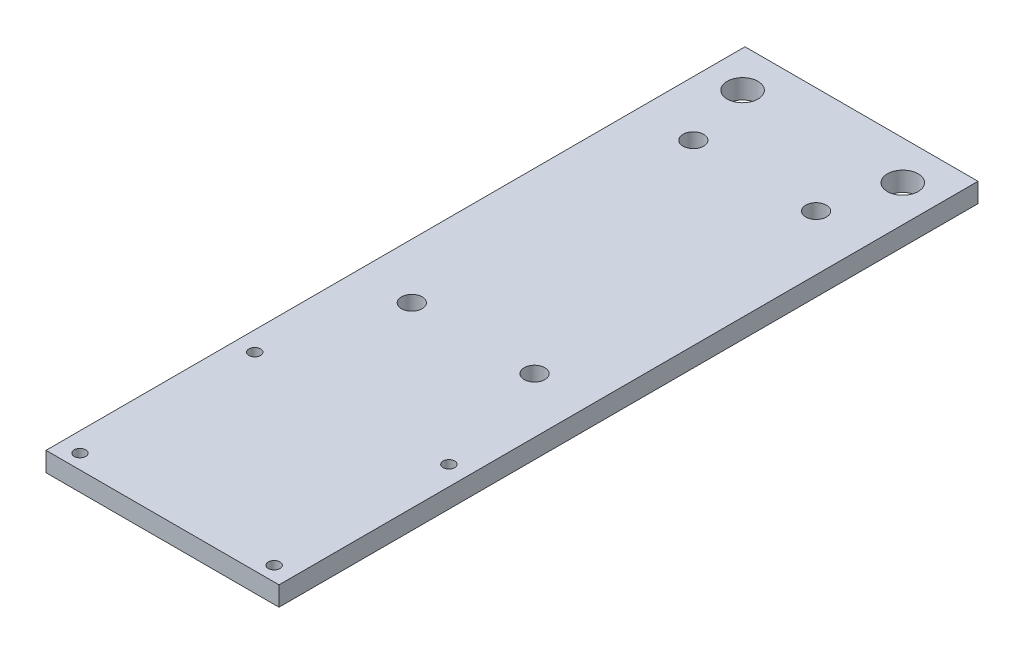
from build123d import *

# Parameters (mm, degrees)
PLATE_SKETCH_W          = 76.2
PLATE_SKETCH_H          = 228.6
PLATE_EXTRUDE_DEPTH     = 6.35
F_1_4_CLEARANCE_HOLE2_D = 6.7564
F_6_CLEARANCE_HOLE1_D   = 3.7973
F_3_8_CLEARANCE_HOLE1_D = 10.0838


with BuildPart() as part:
    # Plate sketch → Plate extrude (new body)
    with BuildSketch(Plane(origin=(0, 0, 0), x_dir=(1, 0, 0), z_dir=(0, 1, 0))):
        Rectangle(PLATE_SKETCH_W, PLATE_SKETCH_H)
    extrude(amount=PLATE_EXTRUDE_DEPTH)

    # 1/4 Clearance Hole2 (through all)
    with Locations(Plane(origin=(0, 6.35, 0), x_dir=(1, 0, 0), z_dir=(0, 1, 0))):
        with Locations((-20.066, 79.375), (20.066, -12.7), (-20.066, -12.7), (20.066, 79.375)):
            Hole(F_1_4_CLEARANCE_HOLE2_D / 2)

    # #6 Clearance Hole1 (through all)
    with Locations(Plane(origin=(0, 6.35, 0), x_dir=(1, 0, 0), z_dir=(0, 1, 0))):
        with Locations((-31.75, -52.3875), (-31.75, -109.5375), (31.75, -52.3875), (31.75, -109.5375)):
            Hole(F_6_CLEARANCE_HOLE1_D / 2)

    # 3/8 Clearance Hole1 (through all)
    with Locations(Plane(origin=(0, 6.35, 0), x_dir=(1, 0, 0), z_dir=(0, 1, 0))):
        with Locations((-26.19375, 101.6), (26.19375, 101.6)):
            Hole(F_3_8_CLEARANCE_HOLE1_D / 2)


solid = part.part
